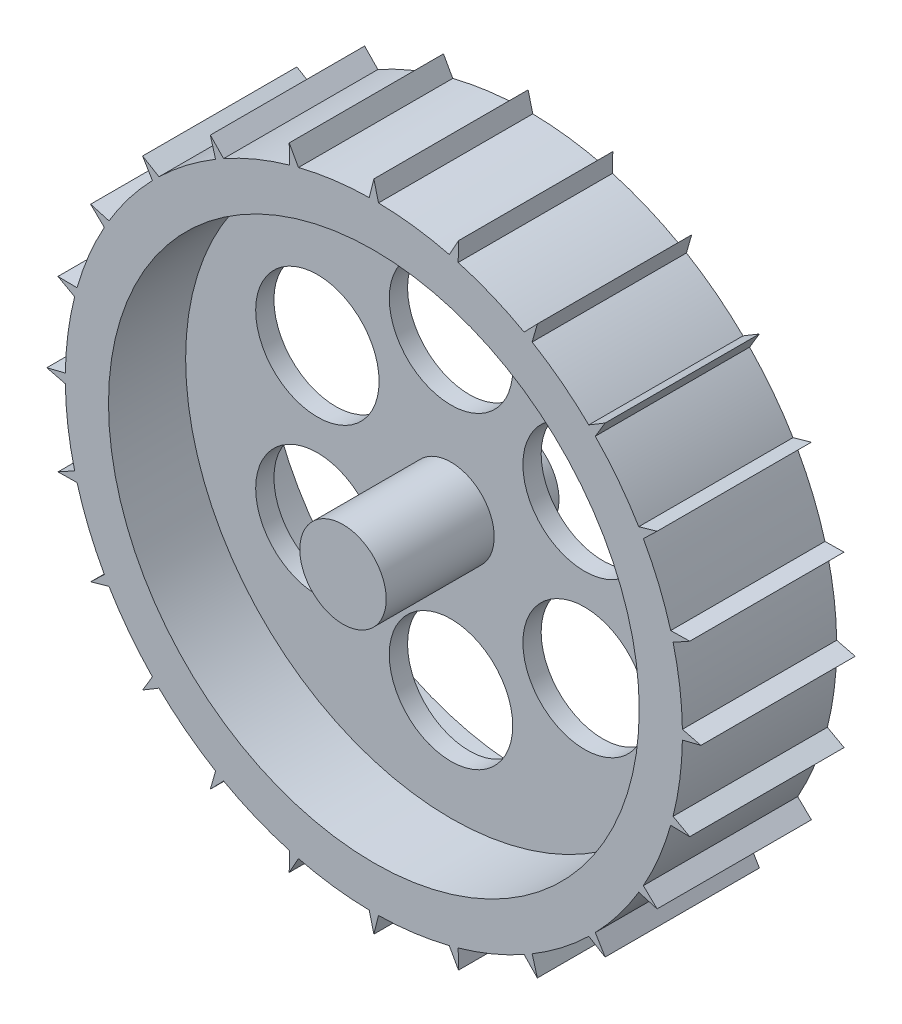
from build123d import *

# Parameters (mm, degrees)
SKETCH1_R           = 50
BOSS_EXTRUDE1_DEPTH = 25
SKETCH2_W           = 9.541105513
SKETCH2_H           = 36
SKETCH2_W_2         = 12.5
SKETCH2_4_W         = 9.541105513
SKETCH2_4_H         = 36
SKETCH2_4_W_2       = 12.5
SKETCH5_W           = 5
SKETCH5_H           = 7
SKETCH6_W           = 2
SKETCH6_H           = 9
SKETCH7_R           = 10
CUT_EXTRUDE1_DEPTH  = 74.610911988
BOSS_EXTRUDE2_DEPTH = 25
CIRPATTERN1_DEPTH   = 25


# Read off the part's stored shape, not the designer's step: CirPattern1
with BuildPart() as part:
    # Sketch1 → Boss-Extrude1 (new body)
    with BuildSketch(Plane.XY):
        Circle(SKETCH1_R)
    extrude(amount=BOSS_EXTRUDE1_DEPTH)

    # Sketch2 → Revolve1 (revolve)
    with BuildSketch(Plane(origin=(0, 0, 0), x_dir=(0, 0, -1), z_dir=(1, 0, 0))):
        with Locations((-4.770552756, -25)):
            Rectangle(SKETCH2_W, SKETCH2_H)
        with Locations((-18.75, -25)):
            Rectangle(SKETCH2_W_2, SKETCH2_H)
    revolve(axis=Axis((0, 0, -54.580519766), (0, 0, 1)))

    # Sketch2<4> → Cut-Revolve1 (revolve, cut)
    with BuildSketch(Plane(origin=(0, 0, 0), x_dir=(0, 0, -1), z_dir=(1, 0, 0)), mode=Mode.PRIVATE) as cut_revolve1_sk:
        with Locations((-4.770552756, -25)):
            Rectangle(SKETCH2_4_W, SKETCH2_4_H)
        with Locations((-18.75, -25)):
            Rectangle(SKETCH2_4_W_2, SKETCH2_4_H)
    revolve(cut_revolve1_sk.sketch.rotate(Axis((0, 0, -54.580519766), (0, 0, 1)), 270), axis=Axis((0, 0, -54.580519766), (0, 0, 1)), mode=Mode.SUBTRACT)

    # Sketch5 → Revolve3 (revolve)
    with BuildSketch(Plane(origin=(0, 0, 0), x_dir=(0, 0, -1), z_dir=(1, 0, 0)), mode=Mode.PRIVATE) as revolve3_sk:
        with Locations((-27.5, -3.5)):
            Rectangle(SKETCH5_W, SKETCH5_H)
    revolve(revolve3_sk.sketch.rotate(Axis((0, 0, 64.707463348), (0, 0, -1)), 90), axis=Axis((0, 0, 64.707463348), (0, 0, -1)))

    # Sketch6 → Cut-Revolve2 (revolve, cut)
    with BuildSketch(Plane(origin=(0, 0, 0), x_dir=(0, 0, -1), z_dir=(1, 0, 0)), mode=Mode.PRIVATE) as cut_revolve2_sk:
        with Locations((-1, -4.5)):
            Rectangle(SKETCH6_W, SKETCH6_H)
    revolve(cut_revolve2_sk.sketch.rotate(Axis((0, 0, -41.001610393), (0, 0, 1)), 270), axis=Axis((0, 0, -41.001610393), (0, 0, 1)), mode=Mode.SUBTRACT)

    # Sketch7 → Cut-Extrude1 (cut, through all)
    with BuildSketch(Plane(origin=(0, 0, 9.541105513), x_dir=(-1, 0, 0), z_dir=(0, 0, -1))):
        with Locations((0, 25)):
            Circle(SKETCH7_R)
        with Locations((21.650635095, 12.5)):
            Circle(SKETCH7_R)
        with Locations((21.650635095, -12.5)):
            Circle(SKETCH7_R)
        with Locations((0, -25)):
            Circle(SKETCH7_R)
        with Locations((-21.650635095, -12.5)):
            Circle(SKETCH7_R)
        with Locations((-21.650635095, 12.5)):
            Circle(SKETCH7_R)
    extrude(amount=-CUT_EXTRUDE1_DEPTH, mode=Mode.SUBTRACT)

    # Sketch8 → Boss-Extrude2 (add)
    with BuildSketch(Plane(origin=(0, 0, 0), x_dir=(-1, 0, 0), z_dir=(0, 0, -1))):
        with BuildLine():
            Line((-0.75, 49.994374684), (0, 52.994374684))
            Line((0, 52.994374684), (0.75, 49.994374684))
            ThreePointArc((0.75, 49.994374684), (0, 50), (-0.75, 49.994374684))
        make_face()
    extrude(amount=-BOSS_EXTRUDE2_DEPTH)

    # CirPattern1 outline → CirPattern1 (add)
    with BuildSketch(Plane.XY):
        with BuildLine():
            Line((-12.215051946, 48.48497196), (-13.715953451, 51.188635155))
            Line((-13.715953451, 51.188635155), (-13.663940686, 48.096743393))
            ThreePointArc((-13.663940686, 48.096743393), (-12.940952255, 48.296291315), (-12.215051946, 48.48497196))
        make_face()
        with BuildLine():
            ThreePointArc((12.215051946, 48.48497196), (12.940952255, 48.296291315), (13.663940686, 48.096743393))
            Line((13.663940686, 48.096743393), (13.715953451, 51.188635155))
            Line((13.715953451, 51.188635155), (12.215051946, 48.48497196))
        make_face()
        with BuildLine():
            ThreePointArc((24.347668289, 43.671398523), (25, 43.301270189), (25.646706395, 42.921398522))
            Line((25.646706395, 42.921398522), (26.497187342, 45.894474734))
            Line((26.497187342, 45.894474734), (24.347668289, 43.671398523))
        make_face()
        with BuildLine():
            ThreePointArc((34.821031274, 35.881691446), (35.35533906, 35.35533906), (35.881691446, 34.821031274))
            Line((35.881691446, 34.821031274), (37.472681703, 37.472681703))
            Line((37.472681703, 37.472681703), (34.821031274, 35.881691446))
        make_face()
        with BuildLine():
            ThreePointArc((42.921398522, 25.646706395), (43.301270189, 25), (43.671398522, 24.347668289))
            Line((43.671398522, 24.347668289), (45.894474734, 26.497187342))
            Line((45.894474734, 26.497187342), (42.921398522, 25.646706395))
        make_face()
        with BuildLine():
            ThreePointArc((48.096743392, 13.663940686), (48.296291315, 12.940952255), (48.48497196, 12.215051946))
            Line((48.48497196, 12.215051946), (51.188635155, 13.715953451))
            Line((51.188635155, 13.715953451), (48.096743392, 13.663940686))
        make_face()
        with BuildLine():
            ThreePointArc((49.994374684, 0.75), (50, 0), (49.994374684, -0.75))
            Line((49.994374684, -0.75), (52.994374684, 0))
            Line((52.994374684, 0), (49.994374684, 0.75))
        make_face()
        with BuildLine():
            ThreePointArc((48.48497196, -12.215051946), (48.296291315, -12.940952255), (48.096743392, -13.663940686))
            Line((48.096743392, -13.663940686), (51.188635155, -13.715953451))
            Line((51.188635155, -13.715953451), (48.48497196, -12.215051946))
        make_face()
        with BuildLine():
            ThreePointArc((43.671398522, -24.347668289), (43.301270189, -25), (42.921398522, -25.646706395))
            Line((42.921398522, -25.646706395), (45.894474734, -26.497187342))
            Line((45.894474734, -26.497187342), (43.671398522, -24.347668289))
        make_face()
        with BuildLine():
            ThreePointArc((35.881691446, -34.821031274), (35.355339059, -35.355339059), (34.821031274, -35.881691446))
            Line((34.821031274, -35.881691446), (37.472681703, -37.472681703))
            Line((37.472681703, -37.472681703), (35.881691446, -34.821031274))
        make_face()
        with BuildLine():
            ThreePointArc((25.646706395, -42.921398522), (25, -43.301270189), (24.347668289, -43.671398522))
            Line((24.347668289, -43.671398522), (26.497187342, -45.894474734))
            Line((26.497187342, -45.894474734), (25.646706395, -42.921398522))
        make_face()
        with BuildLine():
            ThreePointArc((13.663940686, -48.096743392), (12.940952255, -48.296291314), (12.215051946, -48.48497196))
            Line((12.215051946, -48.48497196), (13.715953451, -51.188635155))
            Line((13.715953451, -51.188635155), (13.663940686, -48.096743392))
        make_face()
        with BuildLine():
            ThreePointArc((0.75, -49.994374684), (0, -50), (-0.75, -49.994374684))
            Line((-0.75, -49.994374684), (0, -52.994374684))
            Line((0, -52.994374684), (0.75, -49.994374684))
        make_face()
        with BuildLine():
            ThreePointArc((-12.215051946, -48.48497196), (-12.940952255, -48.296291314), (-13.663940686, -48.096743392))
            Line((-13.663940686, -48.096743392), (-13.715953451, -51.188635155))
            Line((-13.715953451, -51.188635155), (-12.215051946, -48.48497196))
        make_face()
        with BuildLine():
            ThreePointArc((-24.347668289, -43.671398522), (-25, -43.301270189), (-25.646706395, -42.921398522))
            Line((-25.646706395, -42.921398522), (-26.497187342, -45.894474734))
            Line((-26.497187342, -45.894474734), (-24.347668289, -43.671398522))
        make_face()
        with BuildLine():
            ThreePointArc((-34.821031274, -35.881691446), (-35.355339059, -35.355339059), (-35.881691446, -34.821031274))
            Line((-35.881691446, -34.821031274), (-37.472681703, -37.472681703))
            Line((-37.472681703, -37.472681703), (-34.821031274, -35.881691446))
        make_face()
        with BuildLine():
            ThreePointArc((-42.921398522, -25.646706395), (-43.301270189, -25), (-43.671398522, -24.347668289))
            Line((-43.671398522, -24.347668289), (-45.894474734, -26.497187342))
            Line((-45.894474734, -26.497187342), (-42.921398522, -25.646706395))
        make_face()
        with BuildLine():
            ThreePointArc((-48.096743392, -13.663940686), (-48.296291315, -12.940952255), (-48.48497196, -12.215051946))
            Line((-48.48497196, -12.215051946), (-51.188635155, -13.715953451))
            Line((-51.188635155, -13.715953451), (-48.096743392, -13.663940686))
        make_face()
        with BuildLine():
            ThreePointArc((-49.994374684, -0.75), (-50, 0), (-49.994374684, 0.75))
            Line((-49.994374684, 0.75), (-52.994374684, 0))
            Line((-52.994374684, 0), (-49.994374684, -0.75))
        make_face()
        with BuildLine():
            ThreePointArc((-48.48497196, 12.215051946), (-48.296291315, 12.940952255), (-48.096743392, 13.663940686))
            Line((-48.096743392, 13.663940686), (-51.188635155, 13.715953451))
            Line((-51.188635155, 13.715953451), (-48.48497196, 12.215051946))
        make_face()
        with BuildLine():
            ThreePointArc((-43.671398522, 24.347668289), (-43.301270189, 25), (-42.921398522, 25.646706395))
            Line((-42.921398522, 25.646706395), (-45.894474734, 26.497187342))
            Line((-45.894474734, 26.497187342), (-43.671398522, 24.347668289))
        make_face()
        with BuildLine():
            ThreePointArc((-35.881691446, 34.821031274), (-35.35533906, 35.35533906), (-34.821031274, 35.881691446))
            Line((-34.821031274, 35.881691446), (-37.472681703, 37.472681703))
            Line((-37.472681703, 37.472681703), (-35.881691446, 34.821031274))
        make_face()
        with BuildLine():
            ThreePointArc((-25.646706395, 42.921398522), (-25, 43.301270189), (-24.347668289, 43.671398523))
            Line((-24.347668289, 43.671398523), (-26.497187342, 45.894474734))
            Line((-26.497187342, 45.894474734), (-25.646706395, 42.921398522))
        make_face()
    extrude(amount=CIRPATTERN1_DEPTH)


solid = part.part
